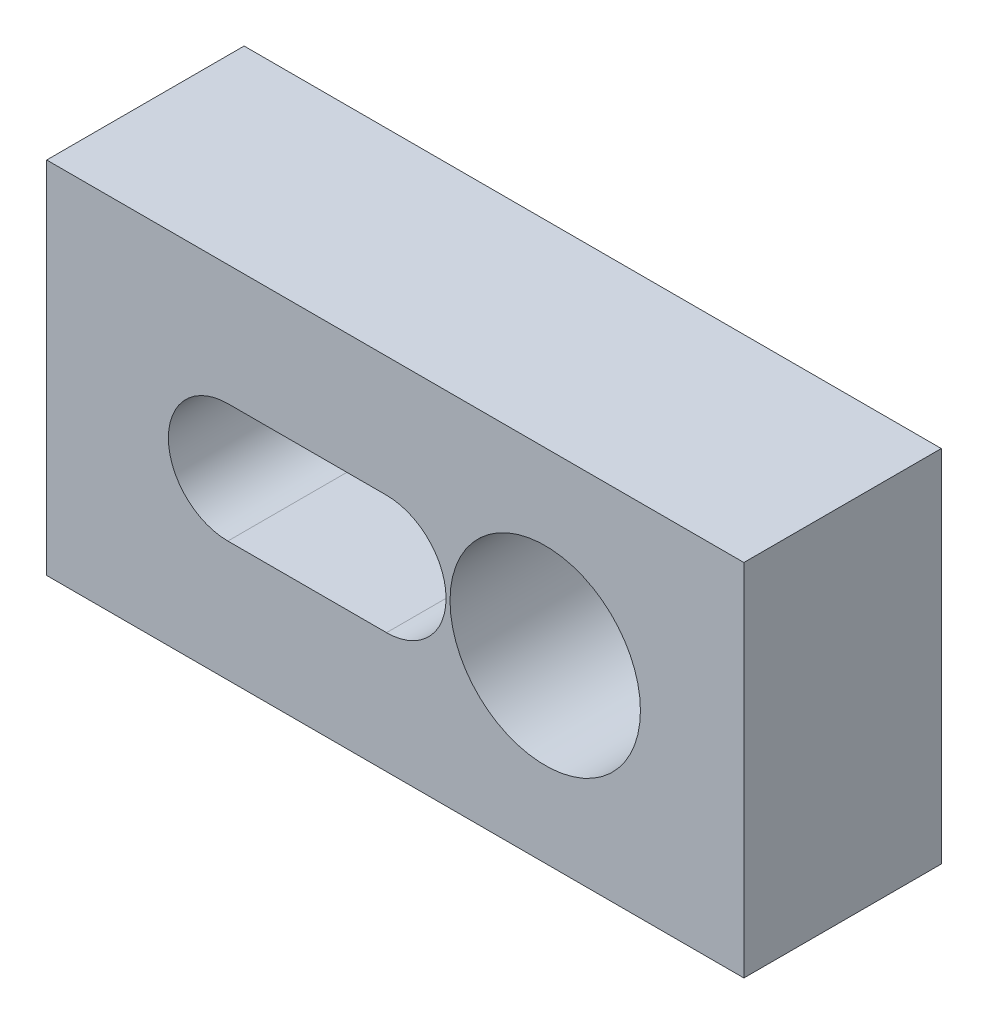
from build123d import *

# Parameters (mm, degrees)
SKETCH1_W           = 55.8
SKETCH1_H           = 15.8
BOSS_EXTRUDE1_DEPTH = 28.8
SKETCH2_R           = 7.62
CUT_EXTRUDE1_DEPTH  = 12.7
SKETCH4_R           = 2.778125
SKETCH4_R_2         = 1.8415
CUT_EXTRUDE2_DEPTH  = 12.7
CUT_EXTRUDE6_START  = -1.905
CUT_EXTRUDE6_DEPTH  = 1.905


with BuildPart() as part:
    # Sketch1 → Boss-Extrude1 (new body)
    with BuildSketch(Plane(origin=(0, 0, 0), x_dir=(1, 0, 0), z_dir=(0, 1, 0))):
        with Locations((-11.199948696, 8.193463303)):
            Rectangle(SKETCH1_W, SKETCH1_H)
    extrude(amount=BOSS_EXTRUDE1_DEPTH)

    # Sketch2 → Cut-Extrude1 (cut)
    with BuildSketch(Plane.XY.offset(-0.293463303)):
        with Locations((0.800051304, 14.4)):
            Circle(SKETCH2_R)
        with BuildLine():
            Line((-11.899948696, 9.6375), (-24.599948696, 9.6375))
            ThreePointArc((-24.599948696, 9.6375), (-29.362448696, 14.4), (-24.599948696, 19.1625))
            Line((-24.599948696, 19.1625), (-11.899948696, 19.1625))
            ThreePointArc((-11.899948696, 19.1625), (-7.137448696, 14.4), (-11.899948696, 9.6375))
        make_face()
    extrude(amount=-CUT_EXTRUDE1_DEPTH, mode=Mode.SUBTRACT)

    # Sketch4 → Cut-Extrude2 (cut)
    with BuildSketch(Plane(origin=(0, 0, -16.093463303), x_dir=(-1, 0, 0), z_dir=(0, 0, -1))):
        with Locations((-0.800051304, 14.4)):
            Circle(SKETCH4_R)
        with Locations((11.899948696, 14.4)):
            Circle(SKETCH4_R_2)
        with Locations((24.599948696, 14.4)):
            Circle(SKETCH4_R_2)
    extrude(amount=-CUT_EXTRUDE2_DEPTH, mode=Mode.SUBTRACT)

    # Sketch5 → Cut-Extrude6 (cut)
    with BuildSketch(Plane(origin=(0, 0, -16.093463303), x_dir=(-1, 0, 0), z_dir=(0, 0, -1)).offset(CUT_EXTRUDE6_START)):
        with BuildLine():
            Line((24.599948696, 19.1625), (11.899948696, 19.1625))
            ThreePointArc((11.899948696, 19.1625), (7.137448696, 14.4), (11.899948696, 9.6375))
            Line((11.899948696, 9.6375), (24.599948696, 9.6375))
            ThreePointArc((24.599948696, 9.6375), (29.362448696, 14.4), (24.599948696, 19.1625))
        make_face()
    extrude(amount=CUT_EXTRUDE6_DEPTH, mode=Mode.SUBTRACT)


solid = part.part
